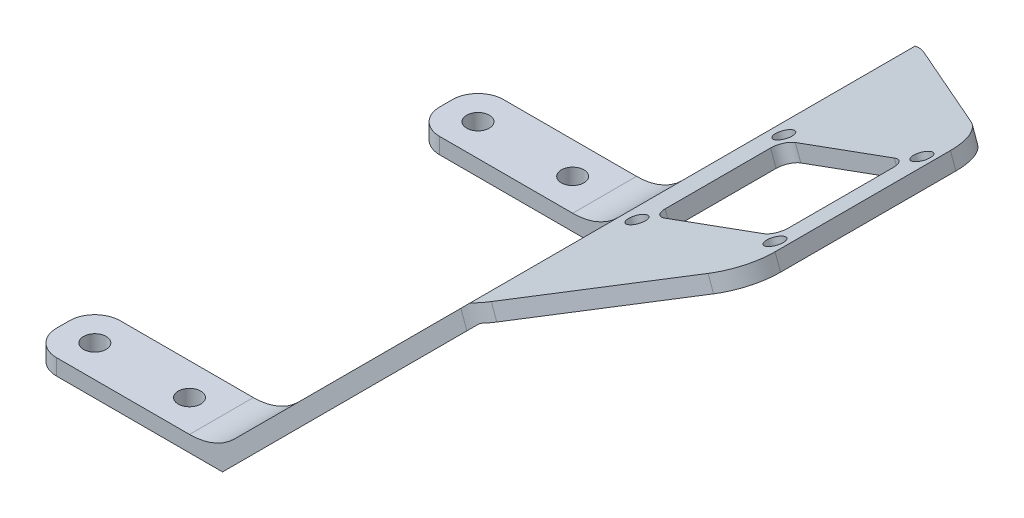
from build123d import *

# Parameters (mm, degrees)
BOSS_EXTRUDE1_DEPTH     = 88.9
SKETCH3_W               = 26.035
SKETCH3_H               = 26.035
CUT_EXTRUDE2_DEPTH      = 74.93
FILLET1_R               = 2.54
CUT_EXTRUDE3_DEPTH      = 164.520153114
CUT_EXTRUDE3_DEPTH_BACK = 164.520153114
FILLET2_R               = 12.7
FILLET3_R               = 12.7
FILLET4_R               = 10.16
CUT_EXTRUDE4_DEPTH      = 164.487937905
CUT_EXTRUDE4_DEPTH_BACK = 164.487937905
SKETCH5_W               = 1.155605494
SKETCH5_H               = 63.5
FILLET5_R               = 5.08
CUT_EXTRUDE5_DEPTH      = 164.487937905
CUT_EXTRUDE5_DEPTH_BACK = 164.487937905
SKETCH6_R               = 2.2479


with BuildPart() as part:
    # Sketch1 → Boss-Extrude1 (new body)
    with BuildSketch(Plane.XY):
        Polygon((0, 0), (38.1, 0), (88.9, 50.8), (122.052919477, 62.866675869), (120.967005522, 65.85019994), (87.152654683, 53.542782743), (36.784871939, 3.175), (0, 3.175), align=None)
    extrude(amount=-BOSS_EXTRUDE1_DEPTH)

    # Sketch3 → Cut-Extrude2 (cut)
    with BuildSketch(Plane(origin=(-5.927480783, 16.285619605, 0), x_dir=(0.9396926207859088, 0.3420201433256679, 0), z_dir=(0.3420201433256679, -0.9396926207859088, 0))):
        with BuildLine():
            Line((103.948597269, -31.59125), (103.948597269, -29.845))
            Line((103.948597269, -29.845), (105.694847269, -29.845))
            ThreePointArc((105.694847269, -29.845), (102.713812052, -28.610214783), (103.948597269, -31.59125))
        make_face()
        with BuildLine():
            Line((105.694847269, -29.845), (103.948597269, -29.845))
            Line((103.948597269, -29.845), (103.948597269, -31.59125))
            ThreePointArc((103.948597269, -31.59125), (105.183382485, -31.079785217), (105.694847269, -29.845))
        make_face()
        with Locations((118.553597269, -44.45)):
            Rectangle(SKETCH3_W, SKETCH3_H)
        with BuildLine():
            ThreePointArc((134.904847269, -29.845), (133.158597269, -28.09875), (131.412347269, -29.845))
            Line((131.412347269, -29.845), (133.158597269, -29.845))
            Line((133.158597269, -29.845), (133.158597269, -31.59125))
            ThreePointArc((133.158597269, -31.59125), (134.393382485, -31.079785217), (134.904847269, -29.845))
        make_face()
        with BuildLine():
            Line((133.158597269, -29.845), (131.412347269, -29.845))
            ThreePointArc((131.412347269, -29.845), (131.923812052, -31.079785217), (133.158597269, -31.59125))
            Line((133.158597269, -31.59125), (133.158597269, -29.845))
        make_face()
        with BuildLine():
            ThreePointArc((134.904847269, -59.055), (134.393382485, -57.820214783), (133.158597269, -57.30875))
            Line((133.158597269, -57.30875), (133.158597269, -59.055))
            Line((133.158597269, -59.055), (131.412347269, -59.055))
            ThreePointArc((131.412347269, -59.055), (133.158597269, -60.80125), (134.904847269, -59.055))
        make_face()
        with BuildLine():
            Line((133.158597269, -59.055), (133.158597269, -57.30875))
            ThreePointArc((133.158597269, -57.30875), (131.923812052, -57.820214783), (131.412347269, -59.055))
            Line((131.412347269, -59.055), (133.158597269, -59.055))
        make_face()
        with BuildLine():
            ThreePointArc((105.694847269, -59.055), (105.183382485, -57.820214783), (103.948597269, -57.30875))
            Line((103.948597269, -57.30875), (103.948597269, -59.055))
            Line((103.948597269, -59.055), (105.694847269, -59.055))
        make_face()
        with BuildLine():
            Line((103.948597269, -59.055), (103.948597269, -57.30875))
            ThreePointArc((103.948597269, -57.30875), (102.713812052, -60.289785217), (105.694847269, -59.055))
            Line((105.694847269, -59.055), (103.948597269, -59.055))
        make_face()
    extrude(amount=-CUT_EXTRUDE2_DEPTH, mode=Mode.SUBTRACT)

    # Fillet1
    fillet1_edges = [part.edges().sort_by_distance(p)[0] for p in [
        (92.70105407, 53.872852754, -31.4325),
        (117.165951452, 62.777347186, -31.4325),
        (117.165951452, 62.777347186, -57.4675),
        (92.70105407, 53.872852754, -57.4675),
    ]]
    fillet(fillet1_edges, radius=FILLET1_R)

    # Sketch4 → Cut-Extrude3 (cut, two sides: drawn at the far end of the back side and taken through both)
    with BuildSketch(Plane(origin=(-5.927480783, 16.285619605, 0), x_dir=(0.9396926207859088, 0.3420201433256679, 0), z_dir=(0.3420201433256679, -0.9396926207859088, 0)).offset(-CUT_EXTRUDE3_DEPTH_BACK)):
        Polygon((136.193897269, -67.6275), (100.913297269, -88.9), (136.193897269, -88.9), align=None)
        Polygon((48.255685329, -12.7), (35.652386673, -12.7), (35.652386673, -76.2), (48.255685329, -76.2), (100.913297269, -44.45), align=None)
        Polygon((121.976342045, -12.7), (136.193897269, -21.2725), (136.193897269, -12.7), align=None)
        Polygon((100.913297269, 0), (121.976342045, -12.7), (136.193897269, -12.7), (136.193897269, 0), align=None)
    extrude(amount=CUT_EXTRUDE3_DEPTH + CUT_EXTRUDE3_DEPTH_BACK, mode=Mode.SUBTRACT)

    # Fillet2
    # the kernel refuses this fillet: 12.7 mm, written as the material it adds along each edge
    with BuildSketch(Plane(origin=(106.909963983, 1.318030631, -44.45), x_dir=(-0.8047299231694688, -0.2928977386570137, -0.5163532370822017), z_dir=(-0.3420201433256679, 0.9396926207859088, 0))) as fillet2_piece_1_section:
        with BuildLine():
            CenterArc((FILLET2_R * 1.65850746269, FILLET2_R), FILLET2_R, 152.175900406, 117.824099594)
            Line((FILLET2_R * 0.774122735992, FILLET2_R * 1.46675866911), (0, 0))
            Line((0, 0), (FILLET2_R * 1.65850746269, 0))
        make_face()
    fillet2_piece_1 = extrude(amount=55.83261194, mode=Mode.PRIVATE)
    fillet2_piece_1 = split(fillet2_piece_1, bisect_by=Plane(origin=(82.567963605, 44.467963605, -44.45), z_dir=(-0.7071067811865475, 0.7071067811865476, 0)), keep=Keep.TOP, mode=Mode.PRIVATE)
    fillet2_piece_1 = split(fillet2_piece_1, bisect_by=Plane(origin=(80.322899575, 46.713027635, -44.45), z_dir=(0.7071067811865475, -0.7071067811865476, 0)), keep=Keep.TOP, mode=Mode.PRIVATE)
    add(fillet2_piece_1)

    # Fillet3
    fillet3_edges = [part.edges().sort_by_distance(p)[0] for p in [
        (36.784871939, 3.175, -6.35),
        (36.784871939, 3.175, -82.55),
    ]]
    fillet(fillet3_edges, radius=FILLET3_R)

    # Fillet4
    fillet4_edges = [part.edges().sort_by_distance(p)[0] for p in [
        (88.357043022, 52.291762035, -88.9),
        (121.509962499, 64.358437904, -67.6275),
        (121.509962499, 64.358437904, -21.2725),
        (88.357043022, 52.291762035, 0),
    ]]
    fillet(fillet4_edges, radius=FILLET4_R)

    # Sketch5 → Cut-Extrude4 (cut, two sides: drawn at the far end of the back side and taken through both)
    with BuildSketch(Plane(origin=(0, 3.175, 0), x_dir=(1, 0, 0), z_dir=(0, 1, 0)).offset(-CUT_EXTRUDE4_DEPTH_BACK)):
        Polygon((36.784871939, 12.7), (36.784871939, 76.2), (31.524359697, 76.2), (0, 76.2), (0, 12.7), (31.524359697, 12.7), align=None)
        with Locations((37.362674686, 44.45)):
            Rectangle(SKETCH5_W, SKETCH5_H)
    extrude(amount=CUT_EXTRUDE4_DEPTH + CUT_EXTRUDE4_DEPTH_BACK, mode=Mode.SUBTRACT)

    # Fillet5
    fillet5_edges = [part.edges().sort_by_distance(p)[0] for p in [
        (0, 1.5875, 0),
        (0, 1.5875, -12.7),
        (0, 1.5875, -76.2),
        (0, 1.5875, -88.9),
    ]]
    fillet(fillet5_edges, radius=FILLET5_R)

    # Sketch6 → Cut-Extrude5 (cut, two sides: drawn at the far end of the back side and taken through both)
    with BuildSketch(Plane(origin=(0, 3.175, 0), x_dir=(1, 0, 0), z_dir=(0, 1, 0)).offset(-CUT_EXTRUDE5_DEPTH_BACK)):
        with Locations(Location((6.35, 82.55, 0), (0, 0, 270))):
            Circle(SKETCH6_R)
        with Locations(Location((25.174359697, 82.55, 0), (0, 0, 270))):
            Circle(SKETCH6_R)
        with Locations(Location((6.35, 6.35, 0), (0, 0, 270))):
            Circle(SKETCH6_R)
        with Locations(Location((25.174359697, 6.35, 0), (0, 0, 270))):
            Circle(SKETCH6_R)
    extrude(amount=CUT_EXTRUDE5_DEPTH + CUT_EXTRUDE5_DEPTH_BACK, mode=Mode.SUBTRACT)


solid = part.part
